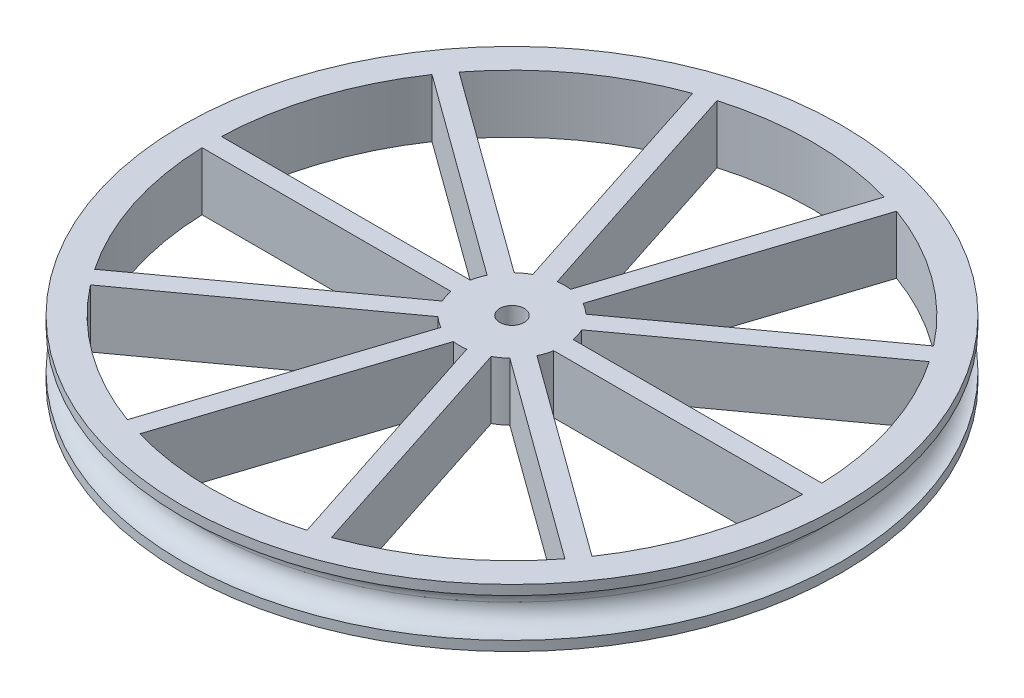
from build123d import *

# Parameters (mm, degrees)
INNERWHEEL_START                            = -0.79375
INNERWHEEL_OUTLINE_R                        = 4.28625
INNERWHEEL_OUTLINE_R_2                      = 3.01625
INNERWHEEL_DEPTH                            = 4.7625
CONNECTIONINNEROUTER_REACH                  = 43.498
CONNECTIONINNEROUTER_END_RADIUS             = 24.60625
SKETCH3_W                                   = 1.5875
SKETCH3_H                                   = 4.7625
CONNECTIONINNEROUTER_DIRECTION_2_REACH      = 43.498
CONNECTIONINNEROUTER_DIRECTION_2_END_RADIUS = 4.28625
CIRCULARPATTERN_COUNT                       = 10
SKETCH4_R                                   = 3.01625
FILLHOLE_DEPTH                              = 4.7625
M2SCREWHOLE_REACH                           = 40.462
M2SCREWDHOLE_R                              = 1
M2SCREWDKHEAD_R                             = 1.8
M2SCREWHEAD_DEPTH                           = 1.28
FILLET_2_R                                  = 1.5875


# Read off the part's stored shape, not the designer's step: InnerWheel
with BuildPart() as part:
    # OuterWheelSketch → OuterWheel (revolve)
    with BuildSketch(Plane.XY, mode=Mode.PRIVATE) as outerwheel_sk:
        Polygon((-25.4, 0), (-26.9875, 0), (-26.9875, -0.79375), (-24.60625, -0.79375), (-24.60625, 3.96875), (-26.9875, 3.96875), (-26.9875, 3.175), (-25.4, 3.175), align=None)
    revolve(outerwheel_sk.sketch.rotate(Axis((0, -1.962659061, 0), (0, 1, 0)), 270), axis=Axis((0, -1.962659061, 0), (0, 1, 0)))



with BuildPart() as body_2:
    # InnerWheel outline → InnerWheel (new body)
    with BuildSketch(Plane(origin=(0, 0, 0), x_dir=(1, 0, 0), z_dir=(0, 1, 0)).offset(INNERWHEEL_START)):
        Circle(INNERWHEEL_OUTLINE_R)
        Circle(INNERWHEEL_OUTLINE_R_2, mode=Mode.SUBTRACT)
    extrude(amount=INNERWHEEL_DEPTH)


with BuildPart() as part_1:
    add(part.part)

    add(body_2.part)  # ConnectionInnerOuter merges body 2
    # ConnectionInnerOuter: up to this cylinder (the profile starts inside it)
    connectioninnerouter_end = Plane(origin=(0, 1.5875, 0), z_dir=(0, -1, 0)) * Cylinder(CONNECTIONINNEROUTER_END_RADIUS, 137.2085, mode=Mode.PRIVATE)
    # Sketch3 → ConnectionInnerOuter (add, up to the surface)
    with BuildSketch(Plane(origin=(4.28625, 0, 0), x_dir=(0, 0, -1), z_dir=(1, 0, 0)), mode=Mode.PRIVATE) as connectioninnerouter_sk1:
        with Locations((0, 1.5875)):
            Rectangle(SKETCH3_W, SKETCH3_H)
    connectioninnerouter_tool1 = extrude(connectioninnerouter_sk1.sketch, amount=CONNECTIONINNEROUTER_REACH, mode=Mode.PRIVATE) & connectioninnerouter_end
    connectioninnerouter = connectioninnerouter_tool1.solids().sort_by_distance((4.28625, 1.5875, 0))[0]
    add(connectioninnerouter)

    # ConnectionInnerOuter direction 2: up to this cylinder (the profile starts outside it)
    connectioninnerouter_direction_2_end = Plane(origin=(0, 1.5875, 0), z_dir=(0, -1, 0)) * Cylinder(CONNECTIONINNEROUTER_DIRECTION_2_END_RADIUS, 96.5685, mode=Mode.PRIVATE)
    # Sketch3 → ConnectionInnerOuter direction 2 (add, up to the surface)
    with BuildSketch(Plane(origin=(4.28625, 0, 0), x_dir=(0, 0, -1), z_dir=(1, 0, 0)), mode=Mode.PRIVATE) as connectioninnerouter_direction_2_sk1:
        with Locations((0, 1.5875)):
            Rectangle(SKETCH3_W, SKETCH3_H)
    connectioninnerouter_direction_2_tool1 = extrude(connectioninnerouter_direction_2_sk1.sketch, amount=-CONNECTIONINNEROUTER_DIRECTION_2_REACH, mode=Mode.PRIVATE) - connectioninnerouter_direction_2_end
    connectioninnerouter_direction_2 = connectioninnerouter_direction_2_tool1.solids().sort_by_distance((4.28625, 1.5875, 0))[0] + connectioninnerouter_direction_2_tool1.solids().sort_by_distance((4.28625, 1.5875, 0))[1]
    add(connectioninnerouter_direction_2)
    connectioninnerouter = connectioninnerouter + connectioninnerouter_direction_2  # both directions under the feature's name, for the pattern or mirror that repeats it

    # CircularPattern: ConnectionInnerOuter ×10 about axis
    circularpattern_axis = Axis((0, 0, 0), (0, 1, 0))
    for i in range(1, CIRCULARPATTERN_COUNT):
        add(connectioninnerouter.rotate(circularpattern_axis, i * 360 / CIRCULARPATTERN_COUNT))

    # Sketch4 → FillHole (add)
    with BuildSketch(Plane(origin=(0, -0.79375, 0), x_dir=(-1, 0, 0), z_dir=(0, -1, 0))):
        Circle(SKETCH4_R)
    extrude(amount=-FILLHOLE_DEPTH)

    # M2ScrewDHole → M2ScrewHole (cut, up to next)
    with BuildSketch(Plane(origin=(0, -0.79375, 0), x_dir=(-1, 0, 0), z_dir=(0, -1, 0)), mode=Mode.PRIVATE) as m2screwhole_sk1:
        with Locations(Location((0, 0, 0), (0, 0, 90))):
            Circle(M2SCREWDHOLE_R)
    m2screwhole_tool1 = extrude(m2screwhole_sk1.sketch, amount=-M2SCREWHOLE_REACH, mode=Mode.PRIVATE) & part_1.part
    add(m2screwhole_tool1.solids().sort_by_distance((0, -0.79375, 0))[0], mode=Mode.SUBTRACT)

    # M2ScrewDKHead → M2ScrewHead (cut)
    with BuildSketch(Plane(origin=(0, -0.79375, 0), x_dir=(-1, 0, 0), z_dir=(0, -1, 0))):
        with Locations(Location((0, 0, 0), (0, 0, 90))):
            Circle(M2SCREWDKHEAD_R)
    extrude(amount=-M2SCREWHEAD_DEPTH, mode=Mode.SUBTRACT)

    # Fillet 2
    fillet_2_edges = [part_1.edges().sort_by_distance(p)[0] for p in [
        (0, 0, 25.4),
        (0, 3.175, 25.4),
    ]]
    fillet(fillet_2_edges, radius=FILLET_2_R - 0.0001)  # a hair under: the kernel refuses the full size


solid = part_1.part
